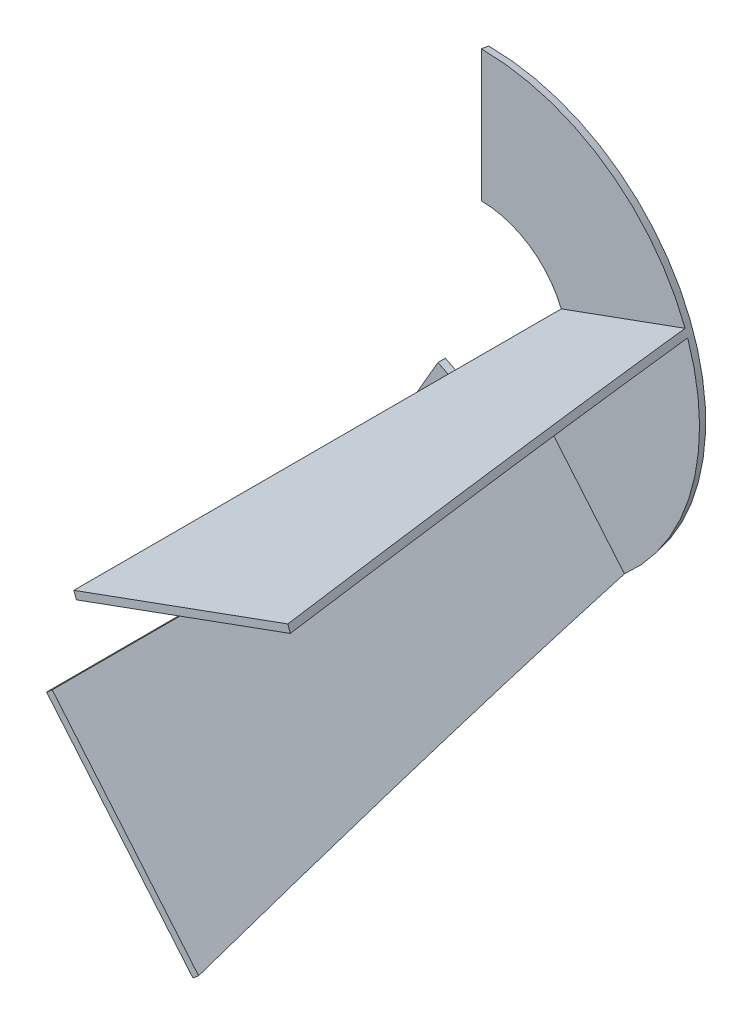
from build123d import *

# Parameters (mm, degrees)
SKETCH3_R          = 35
CUT_EXTRUDE2_DEPTH = 285
CUT_EXTRUDE3_DEPTH = 197


with BuildPart() as part:
    # Loft1: read off the stored shape, not the designer's step
    # Loft1: loft between two sections, ruled curve by curve
    loft1_from = [
        Edge.make_bspline([(-87.451090027, 6.495669107, 0), (-100.442428241, -168.406510946, 0), (74.459751812, -181.397849161, 0), (87.451090027, -6.495669107, 0), (100.442428241, 168.406510946, 0), (-74.459751812, 181.397849161, 0), (-87.451090027, 6.495669107, 0)], [0, 0, 0, 0, 0.5, 0.5, 0.5, 1, 1, 1, 1], 3, [1, 0.333333333, 0.333333333, 1, 0.333333333, 0.333333333, 1]),
    ]
    loft1_to = [
        Edge.make_bspline([(-125.095140395, -21.913599651, 200), (-81.267941093, -272.10388044, 200), (168.922339696, -228.276681139, 200), (125.095140395, 21.913599651, 200), (81.267941093, 272.10388044, 200), (-168.922339696, 228.276681139, 200), (-125.095140395, -21.913599651, 200)], [0, 0, 0, 0, 0.5, 0.5, 0.5, 1, 1, 1, 1], 3, [1, 0.333333333, 0.333333333, 1, 0.333333333, 0.333333333, 1]),
    ]
    loft1 = Solid(Shell([*[Face.make_surface_from_curves(loft1_from[k], loft1_to[k]) for k in range(1)], Face(Wire(loft1_from)), Face(Wire(loft1_to))]))
    add(loft1)

    # Sketch3 → Cut-Extrude2 (cut)
    with BuildSketch(Plane.XY.offset(200)):
        Circle(SKETCH3_R)
        with BuildLine():
            ThreePointArc((-17.5, -30.310889132), (-33.80740392, 9.058666579), (0, 35))
            Line((0, 35), (0, 127))
            ThreePointArc((0, 127), (-97.242036064, 81.688349366), (-125.095140395, -21.913599651))
            ThreePointArc((-125.095140395, -21.913599651), (-104.072977278, -72.786093456), (-63.5, -109.985226281))
            Line((-63.5, -109.985226281), (-17.5, -30.310889132))
        make_face()
    extrude(amount=-CUT_EXTRUDE2_DEPTH, mode=Mode.SUBTRACT)

    # Sketch4 → Cut-Extrude3 (cut)
    with BuildSketch(Plane.XY.offset(200)):
        with BuildLine():
            Line((0, 127), (0, 35))
            ThreePointArc((0, 35), (19.456058328, 29.09401647), (32.345993225, 13.36924539))
            Line((32.345993225, 13.36924539), (118.819608286, 44.843067322))
            ThreePointArc((118.819608286, 44.843067322), (72.228562391, 104.460685308), (0, 127))
        make_face()
        with BuildLine():
            Line((119.845668716, 42.02398946), (33.372053655, 10.550167528))
            ThreePointArc((33.372053655, 10.550167528), (33.80740392, -9.058666579), (23.625962477, -25.822739921))
            Line((23.625962477, -25.822739921), (82.777398912, -96.316676798))
            ThreePointArc((82.777398912, -96.316676798), (122.672579939, -32.870018728), (119.845668716, 42.02398946))
        make_face()
        with BuildLine():
            Line((80.479265582, -98.245039627), (21.327829148, -27.75110275))
            ThreePointArc((21.327829148, -27.75110275), (2.302432535, -34.924186525), (-17.5, -30.310889132))
            Line((-17.5, -30.310889132), (-63.5, -109.985226281))
            ThreePointArc((-63.5, -109.985226281), (10.321427256, -126.579888369), (80.479265582, -98.245039627))
        make_face()
    extrude(amount=-CUT_EXTRUDE3_DEPTH, mode=Mode.SUBTRACT)


solid = part.part
